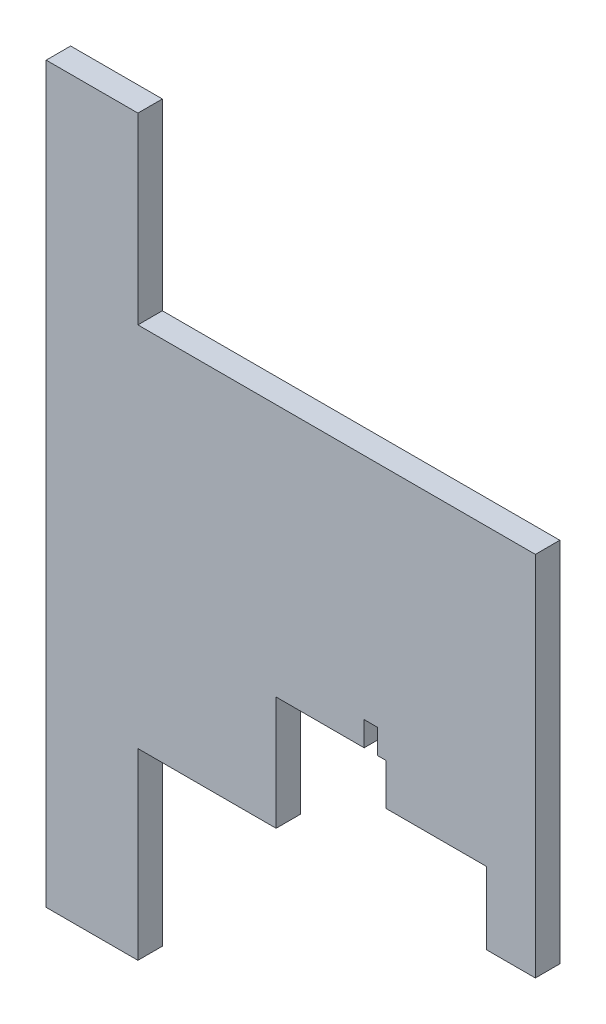
from build123d import *

# Parameters (mm, degrees)
BOSS_EXTRUDE1_DEPTH     = 5.08
CUT_EXTRUDE1_DEPTH      = 142.084368021
CUT_EXTRUDE1_DEPTH_BACK = 142.084368021


with BuildPart() as part:
    # Sketch1 → Boss-Extrude1 (new body)
    with BuildSketch(Plane.XY):
        Polygon((0, 0), (82.55, 0), (82.55, -76.2), (0, -76.2), (0, -114.3), (-19.05, -114.3), (-19.05, 38.1), (0, 38.1), align=None)
    extrude(amount=BOSS_EXTRUDE1_DEPTH)

    # Sketch2 → Cut-Extrude1 (cut, two sides: drawn at the far end of the back side and taken through both)
    with BuildSketch(Plane.XY.offset(5.08).offset(-CUT_EXTRUDE1_DEPTH_BACK)):
        Polygon((28.702, -76.2), (28.702, -52.578), (46.99, -52.578), (46.99, -47.498), (49.784, -47.498), (49.784, -52.578), (51.562, -52.578), (51.562, -61.214), (72.39, -61.214), (72.39, -76.2), align=None)
    extrude(amount=CUT_EXTRUDE1_DEPTH + CUT_EXTRUDE1_DEPTH_BACK, mode=Mode.SUBTRACT)


solid = part.part
